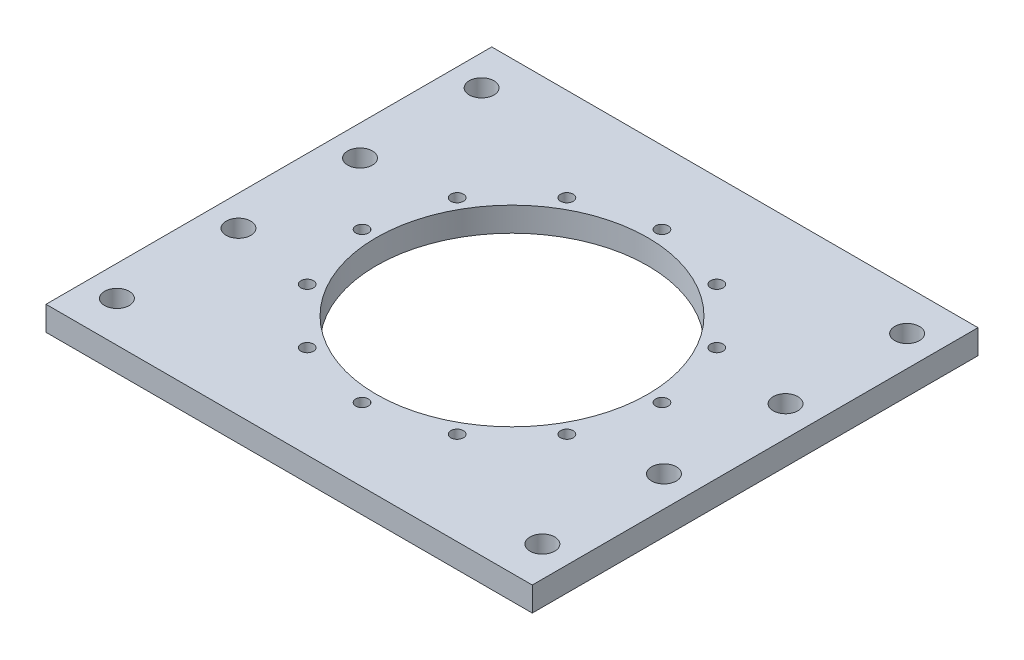
from build123d import *

# Parameters (mm, degrees)
SKETCH1_W            = 120
SKETCH1_H            = 110
BOSS_EXTRUDE1_DEPTH  = 6
SKETCH2_R            = 33.5
CUT_EXTRUDE1_DEPTH   = 82.614949611
M3_CLEARANCE_HOLE1_D = 3.1
CIRPATTERN1_COUNT    = 12
M6_CLEARANCE_HOLE2_D = 6.1


with BuildPart() as part:
    # Sketch1 → Boss-Extrude1 (new body)
    with BuildSketch(Plane(origin=(0, 0, 0), x_dir=(1, 0, 0), z_dir=(0, 1, 0))):
        Rectangle(SKETCH1_W, SKETCH1_H)
    extrude(amount=BOSS_EXTRUDE1_DEPTH)

    # Sketch2 → Cut-Extrude1 (cut, through all)
    with BuildSketch(Plane(origin=(0, 6, 0), x_dir=(1, 0, 0), z_dir=(0, 1, 0))):
        Circle(SKETCH2_R)
    extrude(amount=-CUT_EXTRUDE1_DEPTH, mode=Mode.SUBTRACT)

    # M3 Clearance Hole1 (through all)
    with Locations(Plane(origin=(0, 6, 0), x_dir=(1, 0, 0), z_dir=(0, 1, 0))):
        with Locations((0, 37)):
            m3_clearance_hole1 = Hole(M3_CLEARANCE_HOLE1_D / 2)

    # CirPattern1: M3 Clearance Hole1 ×12 about axis
    cirpattern1_axis = Axis((0, 0, 0), (0, 1, 0))
    for i in range(1, CIRPATTERN1_COUNT):
        add(m3_clearance_hole1.rotate(cirpattern1_axis, i * 360 / CIRPATTERN1_COUNT), mode=Mode.SUBTRACT)

    # M6 Clearance Hole2 (through all)
    with Locations(Plane(origin=(0, 6, 0), x_dir=(1, 0, 0), z_dir=(0, 1, 0))):
        with Locations((52.5, -45), (52.5, -15), (52.5, 15), (52.5, 45)):
            m6_clearance_hole2 = Hole(M6_CLEARANCE_HOLE2_D / 2)

    # Mirror1: M6 Clearance Hole2 across plane
    add(m6_clearance_hole2.mirror(Plane(origin=(0, 0, 0), x_dir=(0, 0, 1), z_dir=(1, 0, 0))), mode=Mode.SUBTRACT)


solid = part.part
